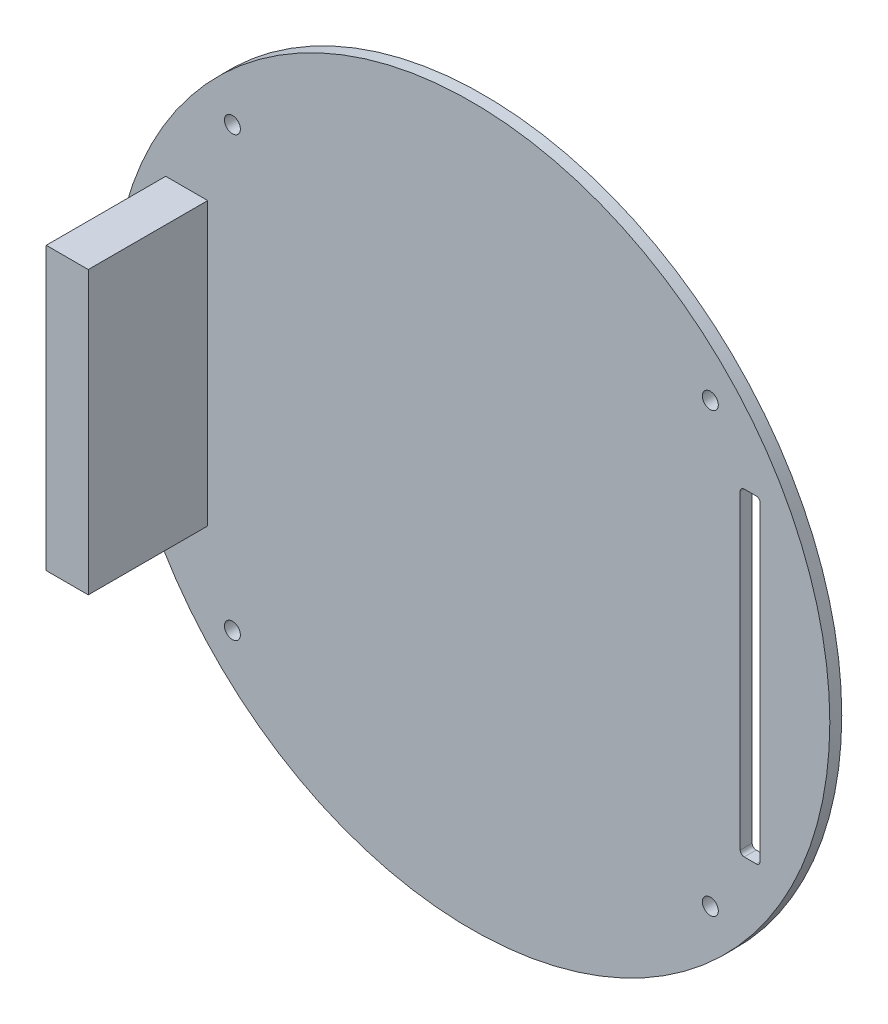
from build123d import *

# Parameters (mm, degrees)
EXTRUDE_1_OUTLINE_R   = 90
EXTRUDE_1_OUTLINE_R_2 = 2
EXTRUDE_1_DEPTH       = 3
SKETCH_4_W            = 10.552817488
SKETCH_4_H            = 70.751844526
EXTRUDE_2_DEPTH       = 30
CUT_EXTRUDE_1_DEPTH   = 30


# Read off the part's stored shape, not the designer's step: 填料-伸長1
with BuildPart() as part:
    # 填料-伸長1 outline → 填料-伸長1 (new body)
    with BuildSketch(Plane.XY):
        Circle(EXTRUDE_1_OUTLINE_R)
        with Locations((-60, -55)):
            Circle(EXTRUDE_1_OUTLINE_R_2, mode=Mode.SUBTRACT)
        with Locations((60, -55)):
            Circle(EXTRUDE_1_OUTLINE_R_2, mode=Mode.SUBTRACT)
        with Locations((-60, 55)):
            Circle(EXTRUDE_1_OUTLINE_R_2, mode=Mode.SUBTRACT)
        with Locations((60, 55)):
            Circle(EXTRUDE_1_OUTLINE_R_2, mode=Mode.SUBTRACT)
    extrude(amount=EXTRUDE_1_DEPTH)

    # 草圖4 → 填料-伸長2 (add)
    with BuildSketch(Plane(origin=(0, 0, 3), x_dir=(-1, 0, 0), z_dir=(0, 0, -1))):
        with Locations((71.471354809, 0)):
            Rectangle(SKETCH_4_W, SKETCH_4_H)
    extrude(amount=-EXTRUDE_2_DEPTH)

    # 草圖5 → 除料-伸長1 (cut)
    with BuildSketch(Plane.XY.offset(3)):
        with BuildLine():
            Line((68.5, -40), (71.5, -40))
            ThreePointArc((71.5, -40), (72.207106781, -39.707106781), (72.5, -39))
            Line((72.5, -39), (72.5, 39))
            ThreePointArc((72.5, 39), (72.207106781, 39.707106781), (71.5, 40))
            Line((71.5, 40), (68.5, 40))
            ThreePointArc((68.5, 40), (67.792893219, 39.707106781), (67.5, 39))
            Line((67.5, 39), (67.5, -39))
            ThreePointArc((67.5, -39), (67.792893219, -39.707106781), (68.5, -40))
        make_face()
    extrude(amount=-CUT_EXTRUDE_1_DEPTH, mode=Mode.SUBTRACT)


solid = part.part
